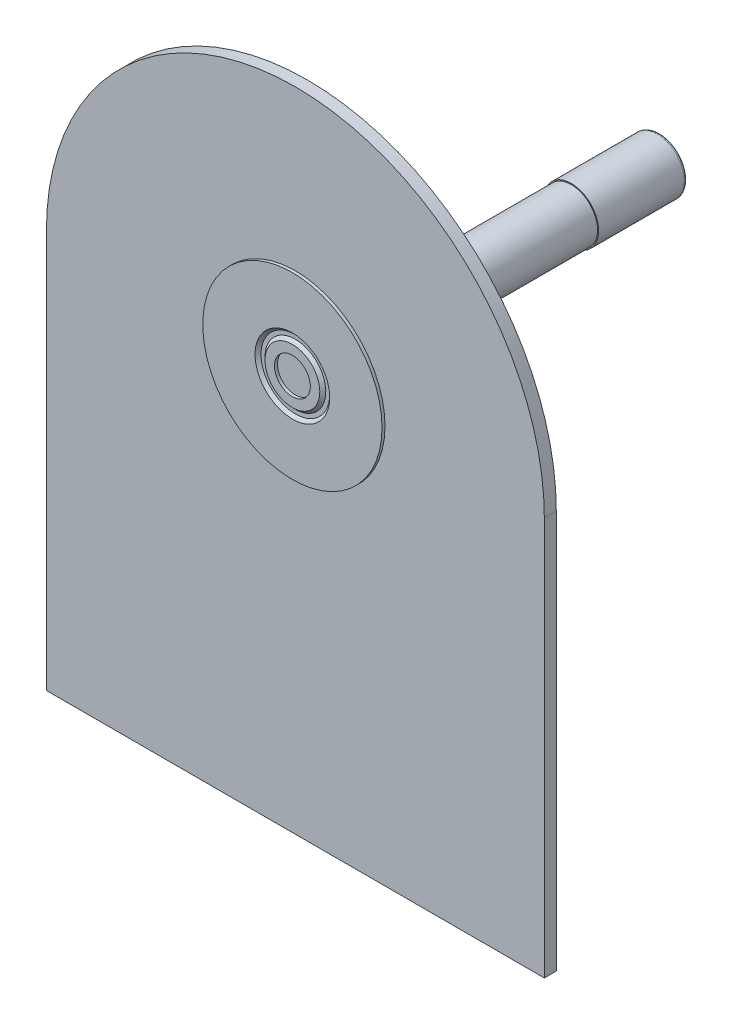
from build123d import *

# Parameters (mm, degrees)
SKETCH_1_R               = 27.5
EXTRUDE_1_DEPTH          = 90
SKETCH_2_R               = 26.5
EXTRUDE_2_DEPTH          = 190
SKETCH_3_R               = 27.5
EXTRUDE_3_DEPTH          = 60
SKETCH_4_R               = 32.5
EXTRUDE_4_DEPTH          = 30
SKETCH_5_R               = 150.00000000000003
EXTRUDE_5_DEPTH          = 20
SKETCH_6_R               = 32.5
CUT_EXTRUDE_1_DEPTH      = 20
CHAMFER_4_SIZE           = 5
SKETCH_8_OUTSIDE_W       = 414.588
SKETCH_8_OUTSIDE_H       = 414.588
SKETCH_8_OUTSIDE_R       = 90
CUT_EXTRUDE_2_DEPTH      = 3
CHAMFER_5_SIZE           = 5
CHAMFER_6_SIZE           = 5
SKETCH_12_R              = 3.000000000000001
CUT_EXTRUDE_4_DEPTH      = 410.2676385936225
PATTERN_CIRCULAR_1_COUNT = 8
SKETCH_13_R              = 18
CUT_EXTRUDE_5_DEPTH      = 427.49736224272243
FILLET_1_R               = 10
FILLET_2_R               = 3
PATTERN_CIRCULAR_2_COUNT = 8
EXTRUDE_6_DEPTH          = 12


with BuildPart() as part:
    # 草图1 → 凸台-拉伸1 (new body)
    with BuildSketch(Plane.XY):
        with Locations(Location((0, 0, 0), (0, 0, 180))):
            Circle(SKETCH_1_R)
    extrude(amount=EXTRUDE_1_DEPTH)

    # 草图2 → 凸台-拉伸2 (add)
    with BuildSketch(Plane.XY.offset(90)):
        Circle(SKETCH_2_R)
    extrude(amount=EXTRUDE_2_DEPTH)

    # 草图3 → 凸台-拉伸3 (add)
    with BuildSketch(Plane.XY.offset(280)):
        with Locations(Location((0, 0, 0), (0, 0, 180))):
            Circle(SKETCH_3_R)
    extrude(amount=EXTRUDE_3_DEPTH)

    # 草图4 → 凸台-拉伸4 (add)
    with BuildSketch(Plane.XY.offset(340)):
        Circle(SKETCH_4_R)
    extrude(amount=EXTRUDE_4_DEPTH)

    # 倒角5
    chamfer_5_edges = [part.edges().sort_by_distance(p)[0] for p in [
        (-32.5, 3.98e-15, 370),
    ]]
    chamfer(chamfer_5_edges, length=CHAMFER_5_SIZE)

    # 草图9 → M12 螺纹孔1 (revolve, cut)
    with BuildSketch(Plane.YZ):
        Polygon((0, 0), (-7.91e-15, 32.31438915704056), (5.099999999999992, 29.25), (5.099999999999995, -2.3e-16), align=None)
    revolve(axis=Axis((0, 0, -6.349999999999991), (0, 0, 1)), mode=Mode.SUBTRACT)

    # 草图13 → 切除-拉伸5 (cut, through all)
    with BuildSketch(Plane(origin=(0, 0, 0), x_dir=(-1, 0, 0), z_dir=(0, 0, -1))):
        Circle(SKETCH_13_R)
    extrude(amount=-CUT_EXTRUDE_5_DEPTH, mode=Mode.SUBTRACT)

    # 圆角1
    # the kernel refuses this fillet: 10 mm, written as the material it takes off along each edge
    with BuildSketch(Plane(origin=(0, 0, 0), x_dir=(-1, 0, 0), z_dir=(0, -1, 0))) as fillet_1_piece_1:
        with BuildLine():
            CenterArc((28, -9.987492177719089), FILLET_1_R, 92.86598398259886, 87.13401601740111)
            Line((27.5, 0), (27.49, 0.19974984355438177))
            ThreePointArc((27.49, 0.19974984355438177), (22.75, 0.2), (18, 0.2))
            Line((18, 0.2), (17.8, 0))
            Line((17.8, 0), (17.8, -9.987492177719089))
            Line((17.8, -9.987492177719089), (18, -9.987492177719089))
        make_face()
    revolve(axis=Axis((0, 0, 0), (0, 0, -1)), mode=Mode.SUBTRACT)

    # 圆角2
    fillet_2_edges = [part.edges().sort_by_distance(p)[0] for p in [
        (27.5, -6.74e-15, 0),
    ]]
    fillet(fillet_2_edges, radius=FILLET_2_R)


with BuildPart() as body_2:
    # 草图5 → 凸台-拉伸5 (new body)
    with BuildSketch(Plane.XY.offset(370)):
        Circle(SKETCH_5_R)
    extrude(amount=-EXTRUDE_5_DEPTH)

    # 草图6 → 切除-拉伸1 (cut)
    with BuildSketch(Plane(origin=(0, 0, 350), x_dir=(-1, 0, 0), z_dir=(0, 0, -1))):
        Circle(SKETCH_6_R)
    extrude(amount=-CUT_EXTRUDE_1_DEPTH, mode=Mode.SUBTRACT)

    # 倒角4
    chamfer_4_edges = [body_2.edges().sort_by_distance(p)[0] for p in [
        (32.5, 3.98e-15, 350),
    ]]
    chamfer(chamfer_4_edges, length=CHAMFER_4_SIZE)

    # 草图8 outside → 切除-拉伸2 (cut)
    with BuildSketch(Plane.XY.offset(370)):
        Rectangle(SKETCH_8_OUTSIDE_W, SKETCH_8_OUTSIDE_H)
        Circle(SKETCH_8_OUTSIDE_R, mode=Mode.SUBTRACT)
    extrude(amount=-CUT_EXTRUDE_2_DEPTH, mode=Mode.SUBTRACT)

    # 倒角6
    chamfer_6_edges = [body_2.edges().sort_by_distance(p)[0] for p in [
        (32.5, 3.98e-15, 370),
    ]]
    chamfer(chamfer_6_edges, length=CHAMFER_6_SIZE)

    # 草图12 → 切除-拉伸4 (cut, through all)
    with BuildSketch(Plane(origin=(0, 0, 350), x_dir=(-1, 0, 0), z_dir=(0, 0, -1))):
        with Locations((7.91e-15, 127.5)):
            Circle(SKETCH_12_R)
    cut_extrude_4 = extrude(amount=-CUT_EXTRUDE_4_DEPTH, mode=Mode.SUBTRACT)

    # 阵列(圆周)1: 切除-拉伸4 ×8 about axis
    pattern_circular_1_axis = Axis((1.1129e-13, 0, 0), (0, 0, 1))
    for i in range(1, PATTERN_CIRCULAR_1_COUNT):
        add(cut_extrude_4.rotate(pattern_circular_1_axis, i * 360 / PATTERN_CIRCULAR_1_COUNT), mode=Mode.SUBTRACT)

    # 草图15 → M12 螺纹孔2 (revolve, cut)
    with BuildSketch(Plane(origin=(-7.91e-15, 127.5, 367), x_dir=(0, -1, 0), z_dir=(1, 0, 0))):
        Polygon((0, 0), (-7.91e-15, 32.314389157040544), (5.0999999999999845, 29.25), (5.099999999999987, -9.3e-16), align=None)
    hole_wizard_m12_2 = revolve(axis=Axis((-7.91e-15, 127.5, 373.34999999999997), (0, 0, -1)), mode=Mode.SUBTRACT)

    # 阵列(圆周)2: M12 螺纹孔2 ×8 about axis
    pattern_circular_2_axis = Axis((-1.1129e-13, 0, 0), (0, 0, 1))
    for i in range(1, PATTERN_CIRCULAR_2_COUNT):
        add(hole_wizard_m12_2.rotate(pattern_circular_2_axis, i * 360 / PATTERN_CIRCULAR_2_COUNT), mode=Mode.SUBTRACT)


with BuildPart() as body_3:
    # 草图17 → 凸台-拉伸6 (new body)
    with BuildSketch(Plane.XY.offset(367)):
        with BuildLine():
            Line((-250, 0), (-250, -400))
            Line((-250, -400), (250, -400))
            Line((250, -400), (250, 0))
            ThreePointArc((250, 0), (1.531e-14, 250), (-250, 0))
        make_face()
    extrude(amount=-EXTRUDE_6_DEPTH)


solid = Compound([part.part, body_2.part, body_3.part])
